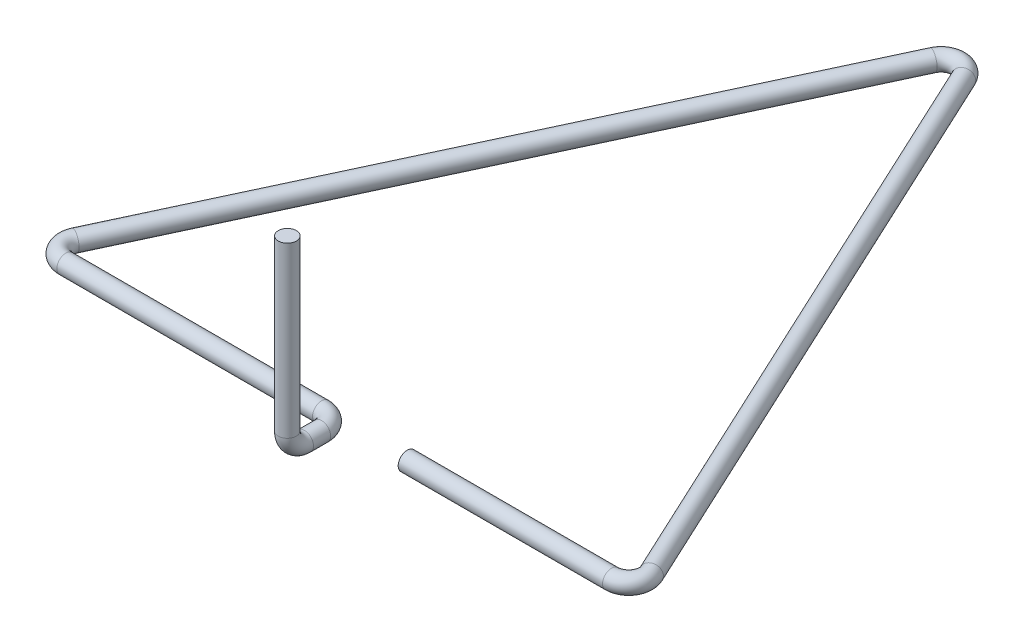
from build123d import *

# Parameters (mm, degrees)
ESBO_O7_R              = 1.585
VARREDURA4_OUTLINE_R   = 1.585
VARREDURA4_ANGLE       = 90
VARREDURA4_START       = -1.5000001
VARREDURA4_2_OUTLINE_R = 1.585
VARREDURA4_2_DEPTH     = 3.0000002
VARREDURA4_START_2     = 2.9999999
VARREDURA4_3_OUTLINE_R = 1.585
VARREDURA4_3_DEPTH     = 29.6000001


with BuildPart() as part:
    # Varredura3: sweep along a path in Esboço1
    with BuildLine(Plane(origin=(0, 0, 0), x_dir=(1, 0, 0), z_dir=(0, 1, 0))) as varredura3_path:
        Line((0, 0), (0, 1.5))
        ThreePointArc((0, 1.5), (-0.878679656, 3.621320344), (-3, 4.5))
        Line((-3, 4.5), (-47.790943269, 4.5))
        ThreePointArc((-47.790943269, 4.5), (-50.321117606, 5.888101175), (-50.50986663, 8.767854785))
        Line((-50.50986663, 8.767854785), (-2.718923361, 111.255863363))
        ThreePointArc((-2.718923361, 111.255863363), (0, 112.988008577), (2.718923361, 111.255863363))
        Line((2.718923361, 111.255863363), (50.50986663, 8.767854785))
        ThreePointArc((50.50986663, 8.767854785), (50.321117606, 5.888101175), (47.790943269, 4.5))
        Line((47.790943269, 4.5), (12, 4.5))
    # Esboço7 → Varredura3 (sweep)
    with BuildSketch(Plane.XY):
        Circle(ESBO_O7_R)
    sweep(path=varredura3_path.line)



with BuildPart() as body_2:
    # Varredura4: read off the stored shape, not the designer's step
    # Varredura4 outline → Varredura4 (revolve)
    with BuildSketch(Plane(origin=(0, 3, 1.5), x_dir=(0, 0, 1), z_dir=(0, 1, 0))):
        with Locations((3, 0)):
            Circle(VARREDURA4_OUTLINE_R)
    revolve(axis=Axis((0, 3, 1.5), (1, 0, 0)), revolution_arc=VARREDURA4_ANGLE)


with BuildPart() as part_1:
    add(part.part)

    add(body_2.part)  # Varredura4 2 merges body 2
    # Varredura4 2 outline → Varredura4 2 (add)
    with BuildSketch(Plane.XY.offset(VARREDURA4_START)):
        Circle(VARREDURA4_2_OUTLINE_R)
    extrude(amount=VARREDURA4_2_DEPTH)

    # Varredura4 3 outline → Varredura4 3 (add)
    with BuildSketch(Plane(origin=(0, 0, 0), x_dir=(1, 0, 0), z_dir=(0, 1, 0)).offset(VARREDURA4_START_2)):
        with Locations((0, -4.5)):
            Circle(VARREDURA4_3_OUTLINE_R)
    extrude(amount=VARREDURA4_3_DEPTH)


solid = part_1.part
